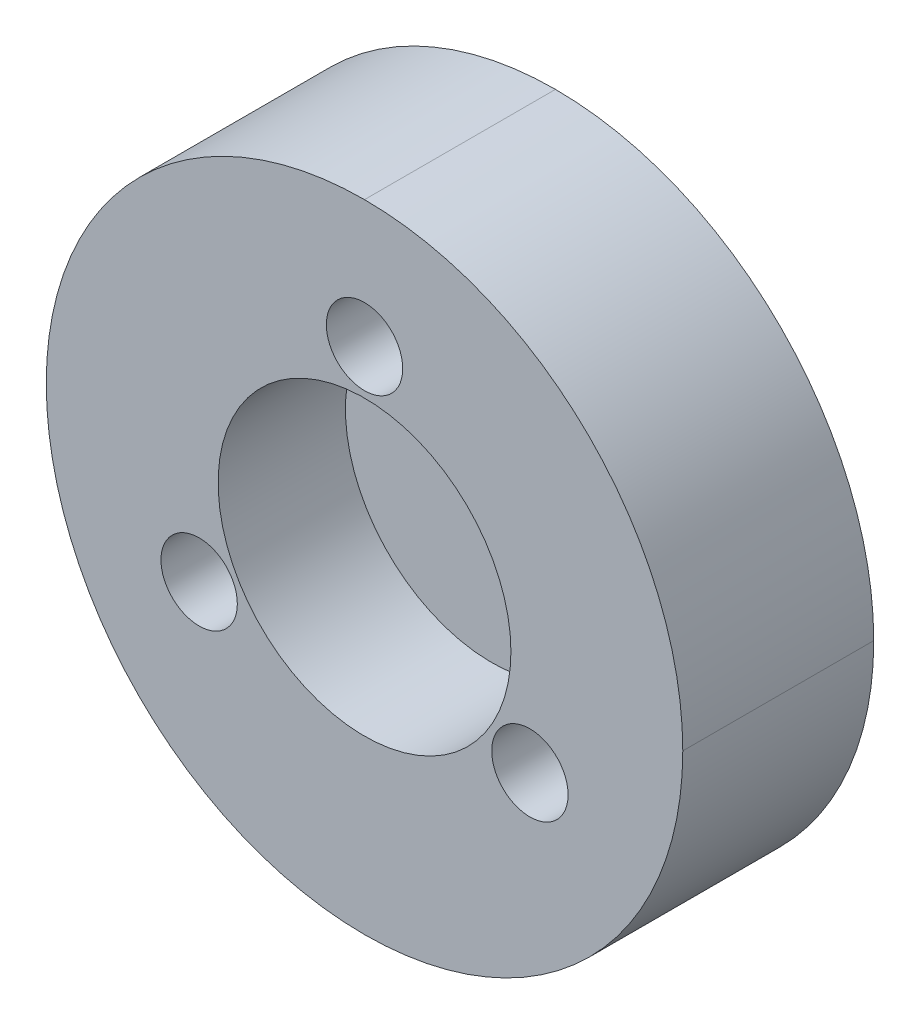
from build123d import *

# Parameters (mm, degrees)
SKETCH1_W                = 20
SKETCH1_H                = 20
SKETCH1_R                = 6
BOSS_EXTRUDE1_DEPTH      = 6
M2_CLEARANCE_HOLE1_D     = 2.4
M2_CLEARANCE_HOLE1_DEPTH = 10
M2_CLEARANCE_HOLE1_TIP   = 0.721032743
FILLET1_R                = 10
SKETCH4_R                = 4.6
CUT_EXTRUDE1_DEPTH       = 4


with BuildPart() as part:
    # Sketch1 → Boss-Extrude1 (new body)
    # profile 1 of 2: a face of its own
    with BuildSketch(Plane.XY):
        with Locations((10, 10)):
            Rectangle(SKETCH1_W, SKETCH1_H)
        with Locations((10, 10)):
            Circle(SKETCH1_R, mode=Mode.SUBTRACT)
    # profile 2 of 2: a face of its own
    with BuildSketch(Plane.XY):
        with Locations((10, 10)):
            Circle(SKETCH1_R)
    extrude(amount=BOSS_EXTRUDE1_DEPTH)

    # M2 Clearance Hole1
    with Locations(Plane.XY.offset(6)):
        with Locations((10, 16), (15.196152423, 7), (4.803847577, 7)):
            Hole(M2_CLEARANCE_HOLE1_D / 2, depth=M2_CLEARANCE_HOLE1_DEPTH)
            with Locations((0, 0, -(M2_CLEARANCE_HOLE1_DEPTH + M2_CLEARANCE_HOLE1_TIP / 2))):  # 118° drill point
                Cone(0, M2_CLEARANCE_HOLE1_D / 2, M2_CLEARANCE_HOLE1_TIP, mode=Mode.SUBTRACT)

    # Fillet1
    fillet1_edges = [part.edges().sort_by_distance(p)[0] for p in [
        (0, 0, 3),
        (20, 0, 3),
        (20, 20, 3),
        (0, 20, 3),
    ]]
    fillet(fillet1_edges, radius=FILLET1_R - 0.0001)  # a hair under: the kernel refuses the full size

    # Sketch4 → Cut-Extrude1 (cut)
    with BuildSketch(Plane.XY.offset(6)):
        with Locations((10, 10)):
            Circle(SKETCH4_R)
    extrude(amount=-CUT_EXTRUDE1_DEPTH, mode=Mode.SUBTRACT)


solid = part.part
